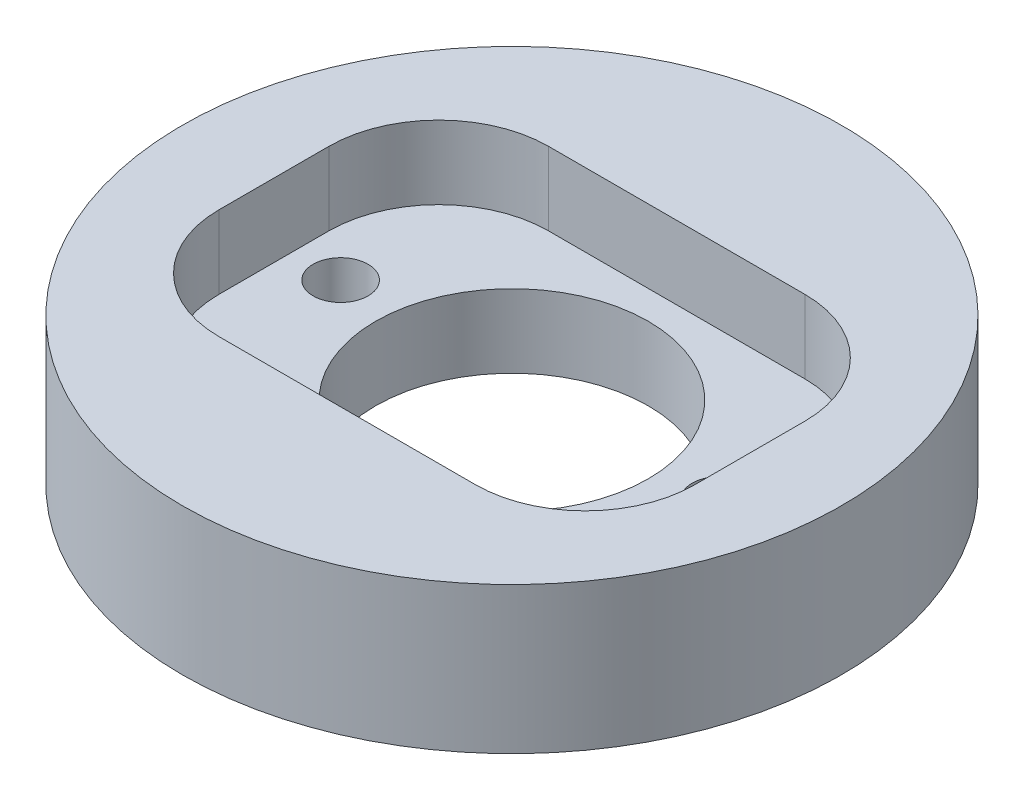
from build123d import *

# Parameters (mm, degrees)
SKETCH2_R           = 9
BOSS_EXTRUDE1_DEPTH = 4
SKETCH3_W           = 13
SKETCH3_H           = 9
CUT_EXTRUDE1_DEPTH  = 2
FILLET1_R           = 3
SKETCH4_R           = 3.725
SKETCH4_R_2         = 0.75
CUT_EXTRUDE2_DEPTH  = 13.884098727


with BuildPart() as part:
    # Sketch2 → Boss-Extrude1 (new body)
    with BuildSketch(Plane(origin=(0, 0, 0), x_dir=(1, 0, 0), z_dir=(0, 1, 0))):
        Circle(SKETCH2_R)
    extrude(amount=BOSS_EXTRUDE1_DEPTH)

    # Sketch3 → Cut-Extrude1 (cut)
    with BuildSketch(Plane(origin=(0, 4, 0), x_dir=(1, 0, 0), z_dir=(0, 1, 0))):
        Rectangle(SKETCH3_W, SKETCH3_H)
    extrude(amount=-CUT_EXTRUDE1_DEPTH, mode=Mode.SUBTRACT)

    # Fillet1
    fillet1_edges = [part.edges().sort_by_distance(p)[0] for p in [
        (-6.5, 3, 4.5),
        (6.5, 3, 4.5),
        (-6.5, 3, -4.5),
        (6.5, 3, -4.5),
    ]]
    fillet(fillet1_edges, radius=FILLET1_R)

    # Sketch4 → Cut-Extrude2 (cut, through all)
    with BuildSketch(Plane(origin=(0, 2, 0), x_dir=(1, 0, 0), z_dir=(0, 1, 0))):
        Circle(SKETCH4_R)
        with Locations((-5.176126951, 0.497704515)):
            Circle(SKETCH4_R_2)
        with Locations((5.176126951, 0.497704515)):
            Circle(SKETCH4_R_2)
    extrude(amount=-CUT_EXTRUDE2_DEPTH, mode=Mode.SUBTRACT)


solid = part.part
